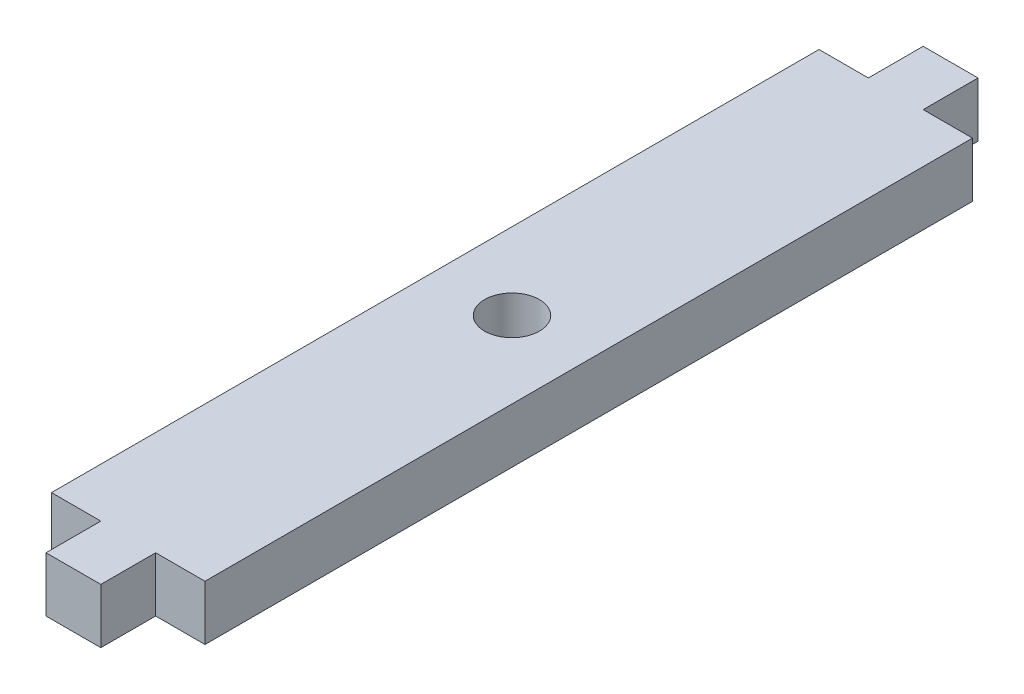
from build123d import *

# Parameters (mm, degrees)
SKETCH1_R           = 3.175
BOSS_EXTRUDE1_DEPTH = 6.35


with BuildPart() as part:
    # Sketch1 → Boss-Extrude1 (new body)
    with BuildSketch(Plane(origin=(0, 0, 0), x_dir=(1, 0, 0), z_dir=(0, 1, 0))):
        Polygon((0, 0), (0, 17.78), (-5.715, 17.78), (-5.715, 24.13), (-12.065, 24.13), (-12.065, 17.78), (-17.78, 17.78), (-17.78, 0), (-17.78, -53.34), (-17.78, -71.12), (-12.065, -71.12), (-12.065, -77.47), (-5.715, -77.47), (-5.715, -71.12), (0, -71.12), (0, -53.34), align=None)
        with Locations((-8.89, -26.67)):
            Circle(SKETCH1_R, mode=Mode.SUBTRACT)
    extrude(amount=BOSS_EXTRUDE1_DEPTH)


solid = part.part
